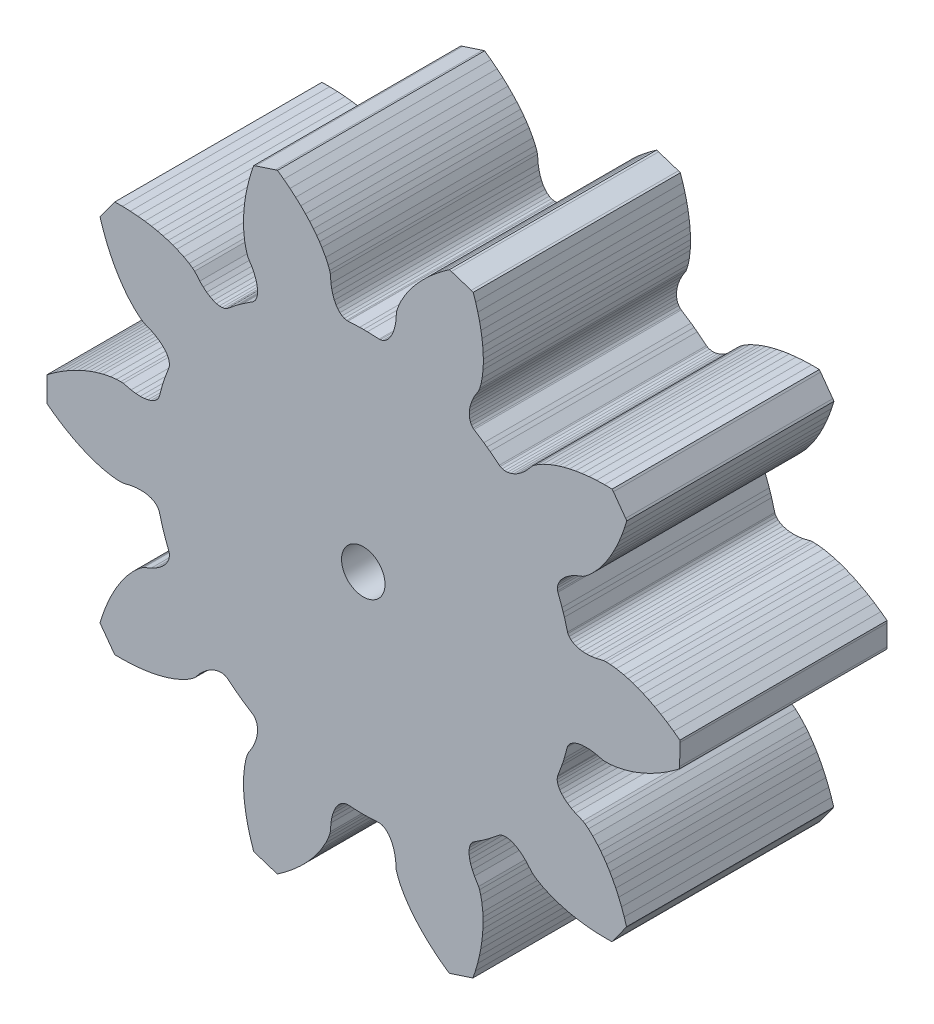
from build123d import *

# Parameters (mm, degrees)
SKETCH2_R           = 1.0500614
BOSS_EXTRUDE1_DEPTH = 10


with BuildPart() as part:
    # Sketch2 → Boss-Extrude1 (new body)
    with BuildSketch(Plane.XY):
        Polygon((2.673589982, 28.084880861), (2.199575182, 28.397808861), (2.156852382, 28.430828861), (2.082404982, 28.516426861), (2.025940782, 28.621074861), (1.988729782, 28.745026861), (1.970797382, 28.888536861), (1.974912182, 29.048302861), (2.001124982, 29.221784861), (2.052102782, 29.409236861), (2.129267982, 29.609134861), (2.231248982, 29.817160861), (2.432442382, 30.145074861), (2.477908382, 30.260898861), (2.534423382, 30.459272861), (2.590912982, 30.741974861), (2.633635782, 31.109766861), (2.644659382, 31.324650861), (2.647427982, 31.561886861), (2.639172982, 31.818172861), (2.618497382, 32.096556861), (2.585401182, 32.391450861), (2.534423382, 32.708442861), (2.468281782, 33.040420861), (2.382836182, 33.391702861), (2.276714982, 33.756954861), (2.158223982, 34.109760861), (2.063126382, 34.145574861), (1.106765582, 34.456978861), (1.010321782, 34.483140861), (0.707147382, 34.266986861), (0.406716182, 34.032544861), (0.129754582, 33.799626861), (-0.118327218, 33.571026861), (-0.344311018, 33.343696861), (-0.545504418, 33.124494861), (-0.726022218, 32.912150861), (-0.883095818, 32.708442861), (-1.020890818, 32.515402861), (-1.138061018, 32.334808861), (-1.319950418, 32.012482861), (-1.439813018, 31.750608861), (-1.510120218, 31.556298861), (-1.543191018, 31.436410861), (-1.572121618, 31.053378861), (-1.612075818, 30.824524861), (-1.667219218, 30.617768861), (-1.736129418, 30.435904861), (-1.817434818, 30.278932861), (-1.906995218, 30.147868861), (-2.006207618, 30.043220861), (-2.109560218, 29.964734861), (-2.217053018, 29.912156861), (-2.325942818, 29.887518861), (-2.381035418, 29.885994861), (-2.947430018, 29.910886861), (-3.133434218, 29.912156861), (-3.319489218, 29.910886861), (-3.885833018, 29.885994861), (-3.899625218, 29.885994861), (-3.953371618, 29.887518861), (-4.062236018, 29.912156861), (-4.169728818, 29.964734861), (-4.274453018, 30.043220861), (-4.372293818, 30.147868861), (-4.463251218, 30.278932861), (-4.543185018, 30.435904861), (-4.612095218, 30.617768861), (-4.667187818, 30.824524861), (-4.707167418, 31.053378861), (-4.736098018, 31.436410861), (-4.769168818, 31.556298861), (-4.839450618, 31.750608861), (-4.959364018, 32.012482861), (-5.142625018, 32.334808861), (-5.258372818, 32.515402861), (-5.396167818, 32.708442861), (-5.553266818, 32.912150861), (-5.733810018, 33.124494861), (-5.935003418, 33.343696861), (-6.160987218, 33.571026861), (-6.410415218, 33.799626861), (-6.686030618, 34.032544861), (-6.986411018, 34.266986861), (-7.289585418, 34.483140861), (-7.387451618, 34.456978861), (-8.343812418, 34.145574861), (-8.437513018, 34.109760861), (-8.556029418, 33.756954861), (-8.662125218, 33.391702861), (-8.747545418, 33.040420861), (-8.815084018, 32.708442861), (-8.864715618, 32.391450861), (-8.899158018, 32.096556861), (-8.918436618, 31.818172861), (-8.926691618, 31.561886861), (-8.923948418, 31.324650861), (-8.912950218, 31.109766861), (-8.870227418, 30.741974861), (-8.813712418, 30.459272861), (-8.757222818, 30.260898861), (-8.713128418, 30.145074861), (-8.510563418, 29.817160861), (-8.408582418, 29.609134861), (-8.331391818, 29.409236861), (-8.280414018, 29.221784861), (-8.254226618, 29.048302861), (-8.250111818, 28.888536861), (-8.268018818, 28.745026861), (-8.305204418, 28.621074861), (-8.361719418, 28.516426861), (-8.436116018, 28.430828861), (-8.478838818, 28.397808861), (-8.952904418, 28.084880861), (-9.103094618, 27.977438861), (-9.253310218, 27.867202861), (-9.697022818, 27.513126861), (-9.742488818, 27.482900861), (-9.844495218, 27.438704861), (-9.962986218, 27.416606861), (-10.092526218, 27.419400861), (-10.234486818, 27.447086861), (-10.384702418, 27.499410861), (-10.541776018, 27.579166861), (-10.704386818, 27.685338861), (-10.871137818, 27.820466861), (-11.037863418, 27.981502861), (-11.285894418, 28.275126861), (-11.383760618, 28.352342861), (-11.554651818, 28.468166861), (-11.805426018, 28.610152861), (-12.143042818, 28.763060861), (-12.342864618, 28.840022861), (-12.567502218, 28.915968861), (-12.814161618, 28.987596861), (-13.085636818, 29.055160861), (-13.376390618, 29.114342861), (-13.693357218, 29.163872861), (-14.028230818, 29.202480861), (-14.389241018, 29.230166861), (-14.769580618, 29.242612861), (-15.143036818, 29.238294861), (-15.205038218, 29.159808861), (-15.796223218, 28.346754861), (-15.851366618, 28.262680861), (-15.739708218, 27.907334861), (-15.610219018, 27.548940861), (-15.473770218, 27.214092661), (-15.333206618, 26.906778061), (-15.187131218, 26.621536061), (-15.041081218, 26.362456061), (-14.893608818, 26.125423261), (-14.748930418, 25.913231661), (-14.608366818, 25.723036461), (-14.473315018, 25.556285461), (-14.222515418, 25.283438661), (-14.010298418, 25.087757061), (-13.847713018, 24.960960261), (-13.742963418, 24.892075461), (-13.388811218, 24.746025461), (-13.182080618, 24.638532661), (-13.002934418, 24.521413261), (-12.851347218, 24.400128261), (-12.727344418, 24.274703061), (-12.630875218, 24.147957061), (-12.560593418, 24.022557261), (-12.519242218, 23.898503661), (-12.502732218, 23.781384261), (-12.512358818, 23.669776661), (-12.527548018, 23.617427261), (-12.523407818, 23.629797061), (-12.527548018, 23.616004861), (-12.727344418, 23.085449661), (-12.785205618, 22.909072061), (-12.841720618, 22.732694461), (-12.991936218, 22.184257661), (-12.996051018, 22.171837061), (-12.993307818, 22.184257661), (-13.011240218, 22.133254461), (-13.069076018, 22.038182261), (-13.151778418, 21.951365061), (-13.257899618, 21.876943061), (-13.388811218, 21.816313261), (-13.541770018, 21.769450261), (-13.715404418, 21.741865861), (-13.909689018, 21.732239261), (-14.123303018, 21.743288261), (-14.353452418, 21.776333661), (-14.726883218, 21.867291061), (-14.850886018, 21.872777461), (-15.057616618, 21.865919461), (-15.342833218, 21.832848661), (-15.706662818, 21.759798261), (-15.913368018, 21.703308661), (-16.140748818, 21.633052261), (-16.381921818, 21.546209661), (-16.640951018, 21.441485461), (-16.911080018, 21.317457261), (-17.196347418, 21.171407261), (-17.491216018, 21.006002461), (-17.798530618, 20.815832661), (-18.112728618, 20.602269461), (-18.413129338, 20.380400461), (-18.417264458, 20.279791061), (-18.417264458, 19.275221061), (-18.413129338, 19.174611661), (-18.112728618, 18.951371061), (-17.798530618, 18.737757061), (-17.491216018, 18.547612661), (-17.196347418, 18.382233261), (-16.911080018, 18.236132461), (-16.640951018, 18.113526661), (-16.381921818, 18.007405461), (-16.140748818, 17.920588261), (-15.913368018, 17.850306461), (-15.706662818, 17.795163061), (-15.342833218, 17.720766461), (-15.057616618, 17.687721061), (-14.850886018, 17.680812261), (-14.726883218, 17.686349461), (-14.353452418, 17.777281461), (-14.123303018, 17.810352261), (-13.909689018, 17.821375861), (-13.715404418, 17.811723861), (-13.541770018, 17.784164861), (-13.388811218, 17.738698861), (-13.257899618, 17.676672061), (-13.151778418, 17.602275461), (-13.069076018, 17.516829861), (-13.011240218, 17.420335261), (-12.993307818, 17.369357461), (-12.996051018, 17.381778061), (-12.991936218, 17.369357461), (-12.841720618, 16.822292261), (-12.785205618, 16.644517661), (-12.727344418, 16.469511661), (-12.527548018, 15.937584861), (-12.523407818, 15.923818061), (-12.527548018, 15.936213261), (-12.512358818, 15.885235461), (-12.502732218, 15.773602461), (-12.519242218, 15.655086061), (-12.560593418, 15.531083261), (-12.630875218, 15.405658061), (-12.727344418, 15.278886661), (-12.851347218, 15.153512261), (-13.002934418, 15.032227261), (-13.182080618, 14.916479461), (-13.388811218, 14.807615061), (-13.742963418, 14.661514261), (-13.847713018, 14.592629461), (-14.010298418, 14.465832661), (-14.222515418, 14.271548061), (-14.473315018, 13.997304261), (-14.608366818, 13.830578661), (-14.748930418, 13.640408861), (-14.893608818, 13.428166461), (-15.041081218, 13.191184461), (-15.187131218, 12.932104461), (-15.333206618, 12.646837061), (-15.473770218, 12.339522461), (-15.610219018, 12.004674261), (-15.739708218, 11.647778861), (-15.851366618, 11.290832661), (-15.796223218, 11.208181061), (-15.205038218, 10.395127061), (-15.143036818, 10.315193261), (-14.769580618, 10.312450061), (-14.389241018, 10.323473661), (-14.028230818, 10.351032661), (-13.693357218, 10.389615261), (-13.376390618, 10.440593061), (-13.085636818, 10.498479661), (-12.814161618, 10.566018261), (-12.567502218, 10.637671661), (-12.342864618, 10.713439861), (-12.143042818, 10.790630461), (-11.805426018, 10.943589261), (-11.554651818, 11.085524461), (-11.383760618, 11.201272261), (-11.285894418, 11.278437461), (-11.037863418, 11.571959861), (-10.871137818, 11.734596061), (-10.704386818, 11.868250861), (-10.541776018, 11.974346661), (-10.384702418, 12.054280461), (-10.234486818, 12.106629861), (-10.092526218, 12.134214261), (-9.962986218, 12.136957461), (-9.844495218, 12.114910261), (-9.742488818, 12.070815861), (-9.697022818, 12.040488261), (-9.708071818, 12.048768661), (-9.697022818, 12.041885261), (-9.253310218, 11.687707661), (-9.103094618, 11.576074661), (-8.952904418, 11.468632661), (-8.478838818, 11.155780861), (-8.436116018, 11.122735461), (-8.361719418, 11.038661461), (-8.305204418, 10.932540261), (-8.268018818, 10.808537461), (-8.250111818, 10.665205261), (-8.254226618, 10.506760061), (-8.280414018, 10.331728661), (-8.331391818, 10.144302061), (-8.408582418, 9.944480261), (-8.510563418, 9.736428861), (-8.713128418, 9.408438661), (-8.757222818, 9.292690861), (-8.813712418, 9.094266061), (-8.870227418, 8.811767261), (-8.912950218, 8.443797461), (-8.923948418, 8.230234261), (-8.926691618, 7.991829861), (-8.918436618, 7.735493061), (-8.899158018, 7.457159861), (-8.864715618, 7.162240461), (-8.815084018, 6.845299261), (-8.747545418, 6.513194261), (-8.662125218, 6.163182261), (-8.556029418, 5.797981061), (-8.437513018, 5.443828861), (-8.343812418, 5.409386461), (-7.387451618, 5.097957061), (-7.289585418, 5.070372661), (-6.986411018, 5.288101461), (-6.686030618, 5.521019461), (-6.410415218, 5.753886661), (-6.160987218, 5.982664461), (-5.935003418, 6.210019861), (-5.733810018, 6.429120261), (-5.553266818, 6.641362661), (-5.396167818, 6.845299261), (-5.258372818, 7.038237661), (-5.142625018, 7.218755461), (-4.959364018, 7.541183061), (-4.839450618, 7.803031661), (-4.769168818, 7.997341661), (-4.736098018, 8.117229661), (-4.707167418, 8.500312461), (-4.667187818, 8.729064861), (-4.612095218, 8.935795461), (-4.543185018, 9.117684861), (-4.463251218, 9.274783861), (-4.372293818, 9.405695461), (-4.274453018, 9.510419661), (-4.169728818, 9.588956461), (-4.062236018, 9.641356661), (-3.953371618, 9.666147061), (-3.899625218, 9.667518661), (-3.912020418, 9.668890261), (-3.898228218, 9.668890261), (-3.331884418, 9.642728261), (-3.145829418, 9.641356661), (-2.959825218, 9.642728261), (-2.393430618, 9.668890261), (-2.379663818, 9.668890261), (-2.393430618, 9.667518661), (-2.338338018, 9.666147061), (-2.229448218, 9.641356661), (-2.121955418, 9.588956461), (-2.018602818, 9.510419661), (-1.919390418, 9.405695461), (-1.829830018, 9.274783861), (-1.748524618, 9.117684861), (-1.679614418, 8.935795461), (-1.624471018, 8.729064861), (-1.584516818, 8.500312461), (-1.555586218, 8.117229661), (-1.522515418, 7.997341661), (-1.452208218, 7.803031661), (-1.332345618, 7.541183061), (-1.150456218, 7.218755461), (-1.033286018, 7.038237661), (-0.895491018, 6.845299261), (-0.738417418, 6.641362661), (-0.557899618, 6.429120261), (-0.356706218, 6.210019861), (-0.130722418, 5.982664461), (0.117359382, 5.753886661), (0.394320982, 5.521019461), (0.694752182, 5.288101461), (0.997926582, 5.070372661), (1.094370382, 5.097957061), (2.050731182, 5.409386461), (2.145828782, 5.443828861), (2.264319782, 5.797981061), (2.370440982, 6.163182261), (2.455886582, 6.513194261), (2.522028182, 6.845299261), (2.573005982, 7.162240461), (2.606102182, 7.457159861), (2.626777782, 7.735493061), (2.635032782, 7.991829861), (2.632264182, 8.230234261), (2.621240582, 8.443797461), (2.578517782, 8.811767261), (2.522028182, 9.094266061), (2.465513182, 9.292690861), (2.420047182, 9.408438661), (2.218853782, 9.736428861), (2.116872782, 9.944480261), (2.039707582, 10.144302061), (1.988729782, 10.331728661), (1.962516982, 10.506760061), (1.958402182, 10.665205261), (1.976334582, 10.808537461), (2.013545582, 10.932540261), (2.070009782, 11.038661461), (2.144457182, 11.122735461), (2.176130982, 11.148897461), (2.187179982, 11.155780861), (2.661194782, 11.468632661), (2.811410382, 11.576074661), (2.960254382, 11.687707661), (3.403966982, 12.041885261), (3.414990582, 12.048768661), (3.405363982, 12.040488261), (3.450829982, 12.070815861), (3.552810982, 12.114910261), (3.671301982, 12.136957461), (3.800841982, 12.134214261), (3.942777182, 12.106629861), (4.092992782, 12.054280461), (4.250091782, 11.974346661), (4.412702582, 11.868250861), (4.578107382, 11.734596061), (4.746255382, 11.571959861), (4.994159382, 11.278437461), (5.090679382, 11.201272261), (5.261621382, 11.085524461), (5.513843382, 10.943589261), (5.849885382, 10.790630461), (6.051307382, 10.713439861), (6.275843382, 10.637671661), (6.522477382, 10.566018261), (6.794003382, 10.498479661), (7.084833382, 10.440593061), (7.401571382, 10.389615261), (7.736597382, 10.351032661), (8.097531382, 10.323473661), (8.478023382, 10.312450061), (8.851403382, 10.315193261), (8.913379382, 10.395127061), (9.503167382, 11.208181061), (9.559555382, 11.290832661), (9.448049382, 11.647778861), (9.318509382, 12.004674261), (9.182111382, 12.339522461), (9.041395382, 12.646837061), (8.895345382, 12.932104461), (8.749295382, 13.191184461), (8.601975382, 13.428166461), (8.457195382, 13.640408861), (8.316733382, 13.830578661), (8.181605382, 13.997304261), (7.930907382, 14.271548061), (7.718563382, 14.465832661), (7.556003382, 14.592629461), (7.451355382, 14.661514261), (7.095755382, 14.807615061), (6.890523382, 14.916479461), (6.711199382, 15.032227261), (6.559561382, 15.153512261), (6.435609382, 15.278886661), (6.339089382, 15.405658061), (6.268985382, 15.531083261), (6.226313382, 15.655086061), (6.211073382, 15.773602461), (6.220725382, 15.885235461), (6.235711382, 15.936213261), (6.231647382, 15.923818061), (6.235711382, 15.937584861), (6.434339382, 16.469511661), (6.493521382, 16.644517661), (6.549909382, 16.822292261), (6.700277382, 17.369357461), (6.704341382, 17.381778061), (6.701547382, 17.369357461), (6.719581382, 17.420335261), (6.777493382, 17.516829861), (6.860043382, 17.602275461), (6.966215382, 17.676672061), (7.097025382, 17.738698861), (7.250187382, 17.784164861), (7.423669382, 17.811723861), (7.617979382, 17.821375861), (7.830323382, 17.810352261), (8.061717382, 17.777281461), (8.435097382, 17.686349461), (8.559303382, 17.680812261), (8.764535382, 17.687721061), (9.051301382, 17.720766461), (9.415029382, 17.795163061), (9.621785382, 17.850306461), (9.847591382, 17.920588261), (10.090161382, 18.007405461), (10.347971382, 18.113526661), (10.619497382, 18.236132461), (10.904739382, 18.382233261), (11.199633382, 18.547612661), (11.506719382, 18.737757061), (11.821171382, 18.951371061), (12.121399382, 19.174611661), (12.124193382, 19.275221061), (12.136588582, 20.279791061), (12.133794582, 20.380400461), (11.833566582, 20.602269461), (11.519114582, 20.815832661), (11.212028582, 21.006002461), (10.917134582, 21.171407261), (10.631892582, 21.317457261), (10.360366582, 21.441485461), (10.102556582, 21.546209661), (9.859986582, 21.633052261), (9.634180582, 21.703308661), (9.427424582, 21.759798261), (9.063696582, 21.832848661), (8.776930582, 21.865919461), (8.571698582, 21.872777461), (8.447492582, 21.867291061), (8.074112582, 21.776333661), (7.842718582, 21.743288261), (7.630374582, 21.732239261), (7.436064582, 21.741865861), (7.262582582, 21.769450261), (7.109420582, 21.816313261), (6.978610582, 21.876943061), (6.872438582, 21.951365061), (6.789888582, 22.038182261), (6.731976582, 22.133254461), (6.713942582, 22.184257661), (6.716736582, 22.171837061), (6.712672582, 22.184257661), (6.562304582, 22.732694461), (6.505916582, 22.909072061), (6.446734582, 23.085449661), (6.248106582, 23.616004861), (6.244042582, 23.629797061), (6.248106582, 23.617427261), (6.233120582, 23.669776661), (6.223468582, 23.781384261), (6.238708582, 23.898503661), (6.281380582, 24.022557261), (6.351484582, 24.147957061), (6.448004582, 24.274703061), (6.571956582, 24.400128261), (6.723594582, 24.521413261), (6.902918582, 24.638532661), (7.108150582, 24.746025461), (7.463750582, 24.892075461), (7.568398582, 24.960960261), (7.730958582, 25.087757061), (7.943302582, 25.283438661), (8.194000582, 25.556285461), (8.329128582, 25.723036461), (8.469590582, 25.913231661), (8.614370582, 26.125423261), (8.761690582, 26.362456061), (8.907740582, 26.621536061), (9.053790582, 26.906778061), (9.194506582, 27.214092661), (9.330904582, 27.548940861), (9.460444582, 27.907334861), (9.571950582, 28.262680861), (9.515562582, 28.346754861), (8.925774582, 29.159808861), (8.863798582, 29.238294861), (8.490418582, 29.242612861), (8.109926582, 29.230166861), (7.748992582, 29.202480861), (7.413966582, 29.163872861), (7.097228582, 29.114342861), (6.806398582, 29.055160861), (6.534872582, 28.987596861), (6.288238582, 28.915968861), (6.063702582, 28.840022861), (5.862280582, 28.763060861), (5.526238582, 28.610152861), (5.274016582, 28.468166861), (5.103074582, 28.352342861), (5.006554582, 28.275126861), (4.758650582, 27.981502861), (4.590502582, 27.820466861), (4.425097782, 27.685338861), (4.262486982, 27.579166861), (4.105387982, 27.499410861), (3.955172382, 27.447086861), (3.813237182, 27.419400861), (3.683697182, 27.416606861), (3.565206182, 27.438704861), (3.463225182, 27.482900861), (3.417759182, 27.513126861), (3.427385782, 27.504744861), (3.416362182, 27.513126861), (2.972649582, 27.867202861), (2.823805582, 27.977438861), align=None)
        with Locations((-3.145829418, 19.776820261)):
            Circle(SKETCH2_R, mode=Mode.SUBTRACT)
    extrude(amount=BOSS_EXTRUDE1_DEPTH)


solid = part.part
